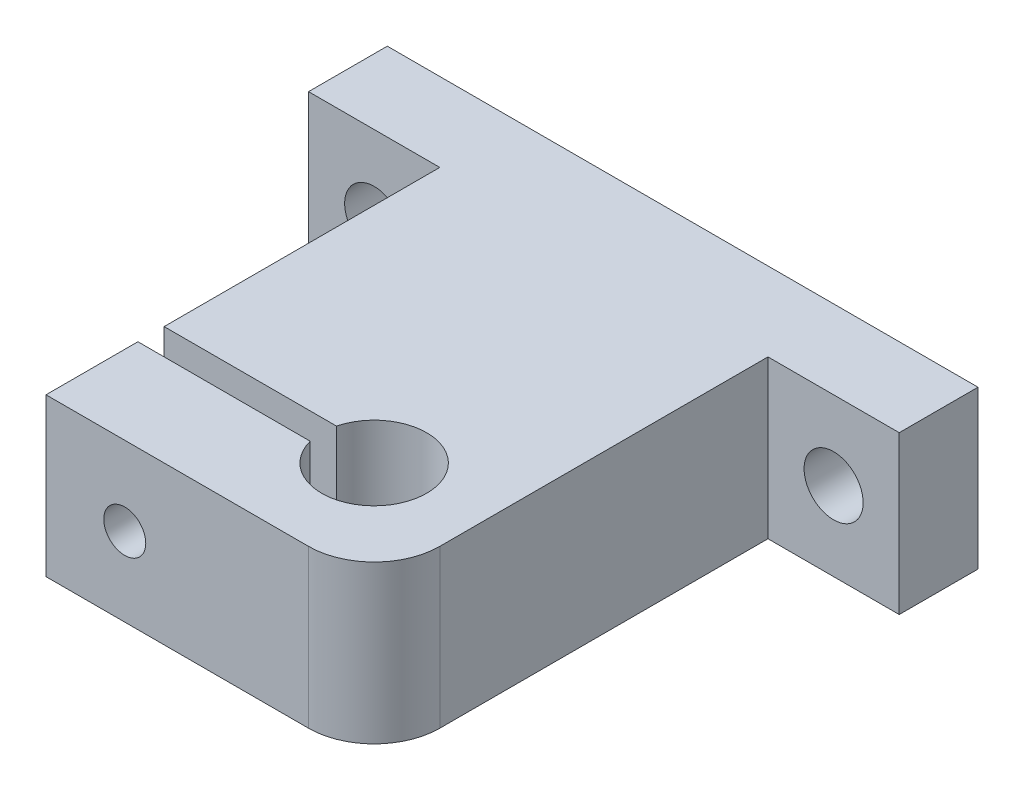
from build123d import *

# Parameters (mm, degrees)
SKETCH2_W           = 45
SKETCH2_H           = 12
SKETCH2_R           = 2.25
BOSS_EXTRUDE1_DEPTH = 6
SKETCH3_W           = 25
SKETCH3_H           = 12
BOSS_EXTRUDE2_DEPTH = 30
FILLET1_R           = 5
CUT_EXTRUDE2_DEPTH  = 30
SKETCH5_W           = 20.513890507
SKETCH5_H           = 7
CUT_EXTRUDE3_DEPTH  = 20
SKETCH6_R           = 1.6
CUT_EXTRUDE4_DEPTH  = 20
CUT_EXTRUDE5_DEPTH  = 3


with BuildPart() as part:
    # Sketch2 → Boss-Extrude1 (new body)
    with BuildSketch(Plane.XY):
        with Locations((22.5, 6)):
            Rectangle(SKETCH2_W, SKETCH2_H)
        with Locations((5, 6)):
            Circle(SKETCH2_R, mode=Mode.SUBTRACT)
        with Locations((40, 6)):
            Circle(SKETCH2_R, mode=Mode.SUBTRACT)
    extrude(amount=BOSS_EXTRUDE1_DEPTH)

    # Sketch3 → Boss-Extrude2 (add)
    with BuildSketch(Plane.XY.offset(6)):
        with Locations((22.5, 6)):
            Rectangle(SKETCH3_W, SKETCH3_H)
    extrude(amount=BOSS_EXTRUDE2_DEPTH)

    # Fillet1
    fillet1_edges = [part.edges().sort_by_distance(p)[0] for p in [
        (35, 6, 36),
    ]]
    fillet(fillet1_edges, radius=FILLET1_R)

    # Sketch4 → Cut-Extrude2 (cut)
    with BuildSketch(Plane.XZ):
        with BuildLine():
            Line((10, 27), (23.127016654, 27))
            ThreePointArc((23.127016654, 27), (31, 28), (23.127016654, 29))
            Line((23.127016654, 29), (10, 29))
            Line((10, 29), (10, 27))
        make_face()
    extrude(amount=-CUT_EXTRUDE2_DEPTH, mode=Mode.SUBTRACT)

    # Sketch5 → Cut-Extrude3 (cut)
    with BuildSketch(Plane(origin=(0, 0, 0), x_dir=(-1, 0, 0), z_dir=(0, 0, -1))):
        with Locations((-22.415473726, 6)):
            Rectangle(SKETCH5_W, SKETCH5_H)
    extrude(amount=-CUT_EXTRUDE3_DEPTH, mode=Mode.SUBTRACT)

    # Sketch6 → Cut-Extrude4 (cut)
    with BuildSketch(Plane.XY.offset(36)):
        with Locations((16, 6)):
            Circle(SKETCH6_R)
    extrude(amount=-CUT_EXTRUDE4_DEPTH, mode=Mode.SUBTRACT)

    # Sketch7 → Cut-Extrude5 (cut)
    with BuildSketch(Plane(origin=(0, 0, 20), x_dir=(-1, 0, 0), z_dir=(0, 0, -1))):
        Polygon((-14.413669184, 3.24920232), (-12.824573921, 5.998403946), (-14.410904737, 8.749201626), (-17.586330816, 8.75079768), (-19.175426079, 6.001596054), (-17.589095263, 3.250798374), align=None)
    extrude(amount=-CUT_EXTRUDE5_DEPTH, mode=Mode.SUBTRACT)


solid = part.part
